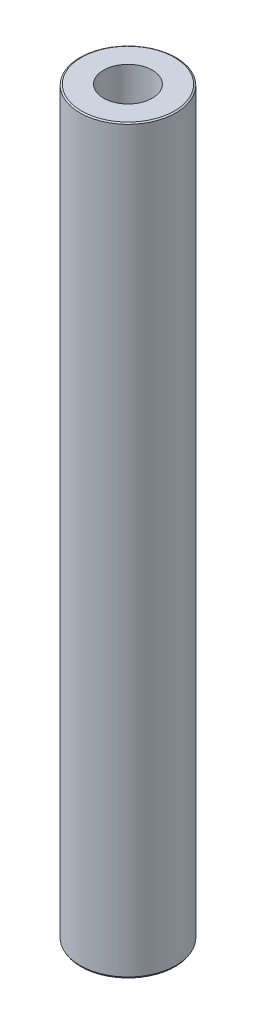
from build123d import *
from OCP.BRepFilletAPI import BRepFilletAPI_MakeChamfer

# Parameters (mm, degrees)
SKETCH1_R           = 35
BOSS_EXTRUDE1_DEPTH = 540.408234828
SKETCH2_R           = 17.753757942
CUT_EXTRUDE1_DEPTH  = 543.670305314
CHAMFER1_SIZE       = 0.640779571
CHAMFER1_SIZE2      = 1.109862774


with BuildPart() as part:
    # Sketch1 → Boss-Extrude1 (new body)
    with BuildSketch(Plane(origin=(0, 0, 0), x_dir=(1, 0, 0), z_dir=(0, 1, 0))):
        Circle(SKETCH1_R)
    extrude(amount=BOSS_EXTRUDE1_DEPTH)

    # Sketch2 → Cut-Extrude1 (cut, through all)
    with BuildSketch(Plane(origin=(0, 0, 0), x_dir=(1, 0, 0), z_dir=(0, 1, 0))):
        Circle(SKETCH2_R)
    extrude(amount=CUT_EXTRUDE1_DEPTH, mode=Mode.SUBTRACT)

    # Chamfer1: one chamfer whose edges measure the first distance from different faces: ONE call of the kernel's chamfer builder (chamfer() names one face for all edges)
    chamfer1_edges_1 = [part.edges().sort_by_distance(p)[0] for p in [
        (-35, 540.408234828, 0),
    ]]
    chamfer1_side_1 = [part.faces().sort_by_distance(p)[0] for p in [
        (-35, 270.204117414, 0),
    ]]
    chamfer1_edges_2 = [part.edges().sort_by_distance(p)[0] for p in [
        (-35, 0, 0),
    ]]
    chamfer1_side_2 = [part.faces().sort_by_distance(p)[0] for p in [
        (-34.010050506, 0, 0),
    ]]
    chamfer1 = BRepFilletAPI_MakeChamfer(part.part.solid().wrapped)
    for e in chamfer1_edges_1:
        chamfer1.Add(CHAMFER1_SIZE, CHAMFER1_SIZE2, e.wrapped, chamfer1_side_1[0].wrapped)  # the first distance lies on this face
    for e in chamfer1_edges_2:
        chamfer1.Add(CHAMFER1_SIZE, CHAMFER1_SIZE2, e.wrapped, chamfer1_side_2[0].wrapped)  # the first distance lies on this face
    add(Compound.cast(chamfer1.Shape()), mode=Mode.REPLACE)


solid = part.part
